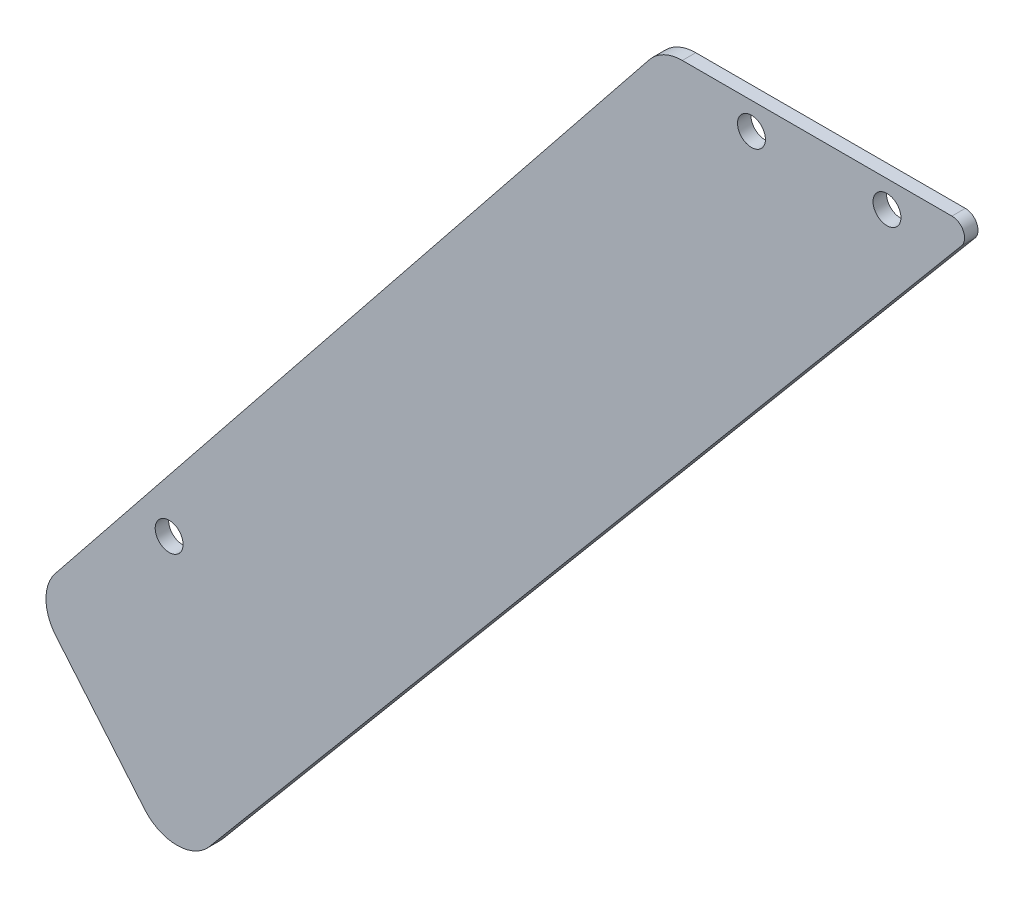
from build123d import *
from OCP.BRepFilletAPI import BRepFilletAPI_MakeFillet

# Parameters (mm, degrees)
SKETCH1_R           = 3.3
BOSS_EXTRUDE1_DEPTH = 3.175
FILLET1_R1          = 10
FILLET1_R2          = 3
SKETCH2_R           = 3.3
CUT_EXTRUDE1_DEPTH  = 263.101316666


with BuildPart() as part:
    # Sketch1 → Boss-Extrude1 (new body)
    with BuildSketch(Plane.XY):
        Polygon((69.714175792, 6.35), (-120.014450201, -219.759771645), (-153.940074272, -179.328787278), (-5.285824208, 6.35), align=None)
        with Locations((47.925, 0)):
            Circle(SKETCH1_R, mode=Mode.SUBTRACT)
        with Locations((15.875, 0)):
            Circle(SKETCH1_R, mode=Mode.SUBTRACT)
    extrude(amount=BOSS_EXTRUDE1_DEPTH)

    # Fillet1: one fillet with a radius per group of edges: ONE call of the kernel's fillet builder (fillet() takes one radius for all edges)
    fillet1_edges_1 = [part.edges().sort_by_distance(p)[0] for p in [
        (-120.014450201, -219.759771645, 1.5875),
        (-153.940074272, -179.328787278, 1.5875),
        (-5.285824208, 6.35, 1.5875),
    ]]
    fillet1_edges_2 = [part.edges().sort_by_distance(p)[0] for p in [
        (69.714175792, 6.35, 1.5875),
    ]]
    fillet1 = BRepFilletAPI_MakeFillet(part.part.solid().wrapped)
    for e in fillet1_edges_1:
        fillet1.Add(FILLET1_R1, e.wrapped)
    for e in fillet1_edges_2:
        fillet1.Add(FILLET1_R2, e.wrapped)
    add(Compound.cast(fillet1.Shape()), mode=Mode.REPLACE)

    # Sketch2 → Cut-Extrude1 (cut, through all)
    with BuildSketch(Plane.XY.offset(3.175)):
        with Locations((-121.871314754, -151.832887913)):
            Circle(SKETCH2_R)
    extrude(amount=-CUT_EXTRUDE1_DEPTH, mode=Mode.SUBTRACT)


solid = part.part
